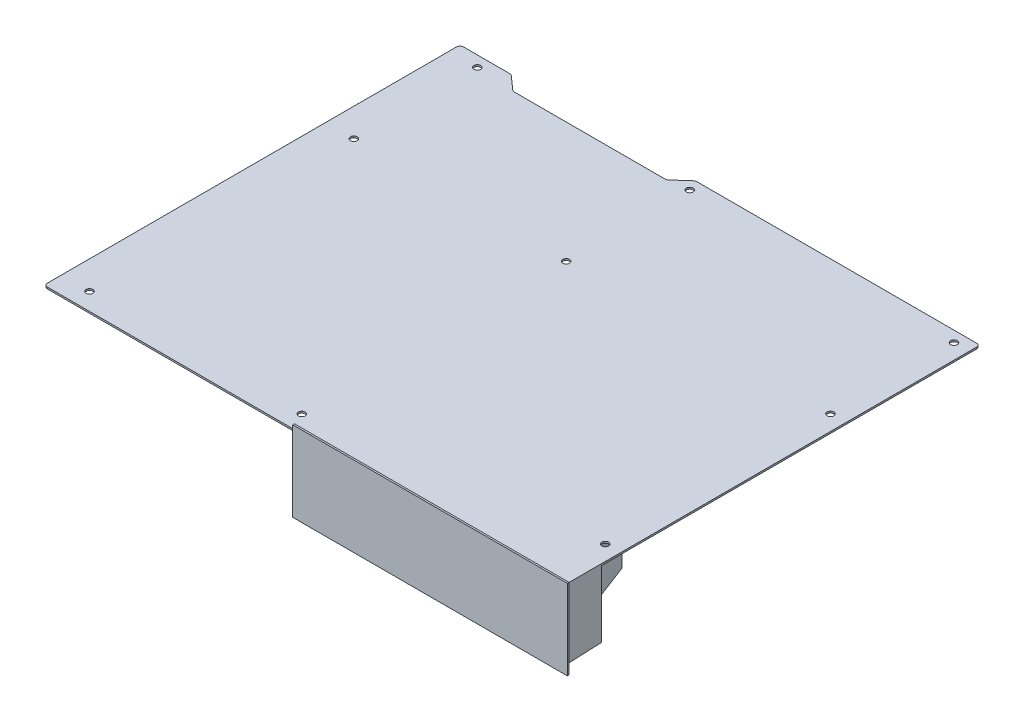
from build123d import *

# Parameters (mm, degrees)
SKETCH1_R           = 1.9812
BOSS_EXTRUDE1_DEPTH = 1
FILLET1_R           = 2
FILLET2_R           = 2
BOSS_EXTRUDE2_DEPTH = 40
SKETCH3_W           = 161
SKETCH3_H           = 47
BOSS_EXTRUDE3_DEPTH = 1
CUT_EXTRUDE1_DEPTH  = 225


with BuildPart() as part:
    # Sketch1 → Boss-Extrude1 (new body)
    with BuildSketch(Plane(origin=(0, 0, 0), x_dir=(1, 0, 0), z_dir=(0, 1, 0))):
        Polygon((-152.4, 121.92), (-152.4, -121.92), (152.4, -121.92), (152.4, 121.92), (-14.4, 121.92), (-23.4, 113.92), (-113.4, 113.92), (-122.4, 121.92), align=None)
        with Locations((-11.43, -111.76)):
            Circle(SKETCH1_R, mode=Mode.SUBTRACT)
        with Locations((143.51, -88.9)):
            Circle(SKETCH1_R, mode=Mode.SUBTRACT)
        with Locations((-135.89, 43.18)):
            Circle(SKETCH1_R, mode=Mode.SUBTRACT)
        with Locations((-11.43, 115.57)):
            Circle(SKETCH1_R, mode=Mode.SUBTRACT)
        with Locations((-135.89, 115.57)):
            Circle(SKETCH1_R, mode=Mode.SUBTRACT)
        with Locations((143.51, 115.57)):
            Circle(SKETCH1_R, mode=Mode.SUBTRACT)
        with Locations((-135.89, -111.76)):
            Circle(SKETCH1_R, mode=Mode.SUBTRACT)
        with Locations((143.51, 43.18)):
            Circle(SKETCH1_R, mode=Mode.SUBTRACT)
        with Locations((-11.43, 43.18)):
            Circle(SKETCH1_R, mode=Mode.SUBTRACT)
    extrude(amount=BOSS_EXTRUDE1_DEPTH)

    # Fillet1
    fillet1_edges = [part.edges().sort_by_distance(p)[0] for p in [
        (-14.4, 0.5, -121.92),
        (-23.4, 0.5, -113.92),
        (-122.4, 0.5, -121.92),
        (-113.4, 0.5, -113.92),
    ]]
    fillet(fillet1_edges, radius=FILLET1_R)

    # Fillet2
    fillet2_edges = [part.edges().sort_by_distance(p)[0] for p in [
        (-152.4, 0.5, 121.92),
        (152.4, 0.5, -121.92),
        (-152.4, 0.5, -121.92),
    ]]
    fillet(fillet2_edges, radius=FILLET2_R)

    # Sketch2 → Boss-Extrude2 (add)
    with BuildSketch(Plane.XZ):
        Polygon((-2.6, 121.92), (152.4, 121.92), (152.4, 99.92), (134.319980014, 91.369393161), (122.529319933, 57.92), (24.529319933, 57.92), (-2.6, 99.92), align=None)
    extrude(amount=BOSS_EXTRUDE2_DEPTH)

    # Sketch3 → Boss-Extrude3 (add)
    with BuildSketch(Plane.XY.offset(121.92)):
        with Locations((74.9, -19.5)):
            Rectangle(SKETCH3_W, SKETCH3_H)
    extrude(amount=BOSS_EXTRUDE3_DEPTH)

    # Sketch4 → Cut-Extrude1 (cut, symmetric)
    with BuildSketch(Plane(origin=(0, 0, 0), x_dir=(0, 0, -1), z_dir=(1, 0, 0))):
        Polygon((-55.675354563, -37), (-121.92, -40), (-121.92, -43.768992378), (-55.675354563, -43.768992378), align=None)
    extrude(amount=CUT_EXTRUDE1_DEPTH, both=True, mode=Mode.SUBTRACT)


solid = part.part
